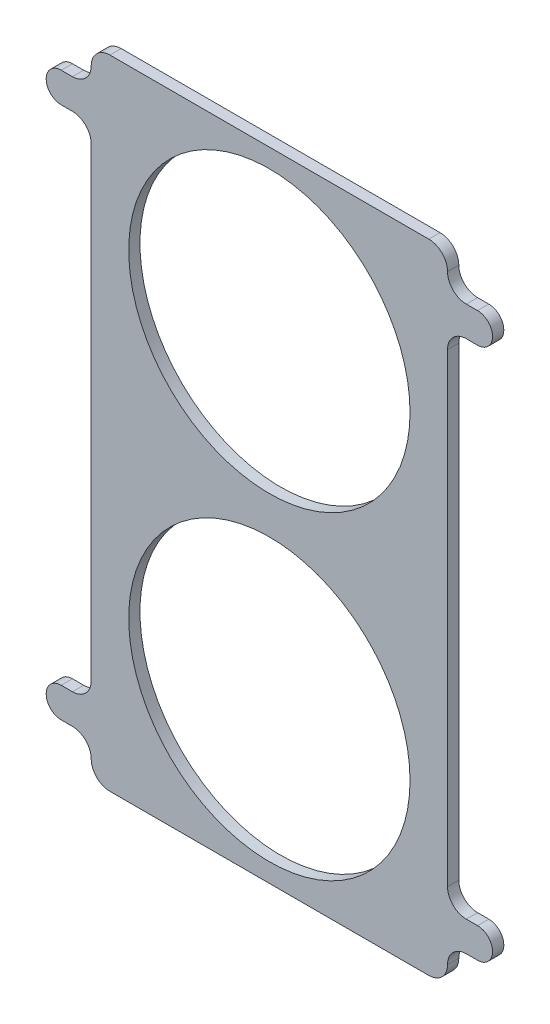
from build123d import *

# Parameters (mm, degrees)
EXTRUDE_1_DEPTH     = 3
FILLET_1_R          = 5
CUT_EXTRUDE_1_REACH = 105.799
SKETCH_2_R          = 37.5


with BuildPart() as part:
    # 草圖1 → 填料-伸長1 (new body)
    with BuildSketch(Plane.XY):
        with BuildLine():
            Line((-47.5, 67), (-47.5, -67))
            Line((-47.5, -67), (-55.5, -67))
            ThreePointArc((-55.5, -67), (-59.5, -71), (-55.5, -75))
            Line((-55.5, -75), (-47.5, -75))
            Line((-47.5, -75), (-47.5, -85))
            Line((-47.5, -85), (47.5, -85))
            Line((47.5, -85), (47.5, -75))
            Line((47.5, -75), (55.5, -75))
            ThreePointArc((55.5, -75), (59.5, -71), (55.5, -67))
            Line((55.5, -67), (47.5, -67))
            Line((47.5, -67), (47.5, 67))
            Line((47.5, 67), (55.5, 67))
            ThreePointArc((55.5, 67), (59.5, 71), (55.5, 75))
            Line((55.5, 75), (47.5, 75))
            Line((47.5, 75), (47.5, 85))
            Line((47.5, 85), (-47.5, 85))
            Line((-47.5, 85), (-47.5, 75))
            Line((-47.5, 75), (-55.5, 75))
            ThreePointArc((-55.5, 75), (-59.5, 71), (-55.5, 67))
            Line((-55.5, 67), (-47.5, 67))
        make_face()
    extrude(amount=EXTRUDE_1_DEPTH)

    # 圓角1
    fillet_1_edges = [part.edges().sort_by_distance(p)[0] for p in [
        (-47.5, 85, 1.5),
        (47.5, 85, 1.5),
        (47.5, 75, 1.5),
        (47.5, 67, 1.5),
        (47.5, -67, 1.5),
        (47.5, -75, 1.5),
        (47.5, -85, 1.5),
        (-47.5, -85, 1.5),
        (-47.5, -75, 1.5),
        (-47.5, -67, 1.5),
        (-47.5, 67, 1.5),
        (-47.5, 75, 1.5),
    ]]
    fillet(fillet_1_edges, radius=FILLET_1_R - 0.0001)  # a hair under: the kernel refuses the full size

    # 草圖2 → 除料-伸長1 (cut, up to next)
    with BuildSketch(Plane.XY.offset(3), mode=Mode.PRIVATE) as cut_extrude_1_sk1:
        with Locations((0, 42.5)):
            Circle(SKETCH_2_R)
    cut_extrude_1_tool1 = extrude(cut_extrude_1_sk1.sketch, amount=-CUT_EXTRUDE_1_REACH, mode=Mode.PRIVATE) & part.part
    # 草圖2 → 除料-伸長1 (cut, up to next)
    with BuildSketch(Plane.XY.offset(3), mode=Mode.PRIVATE) as cut_extrude_1_sk2:
        with Locations((0, -42.5)):
            Circle(SKETCH_2_R)
    cut_extrude_1_tool2 = extrude(cut_extrude_1_sk2.sketch, amount=-CUT_EXTRUDE_1_REACH, mode=Mode.PRIVATE) & part.part
    add(cut_extrude_1_tool1.solids().sort_by_distance((0, 42.5, 3))[0], mode=Mode.SUBTRACT)
    add(cut_extrude_1_tool2.solids().sort_by_distance((0, -42.5, 3))[0], mode=Mode.SUBTRACT)


solid = part.part
